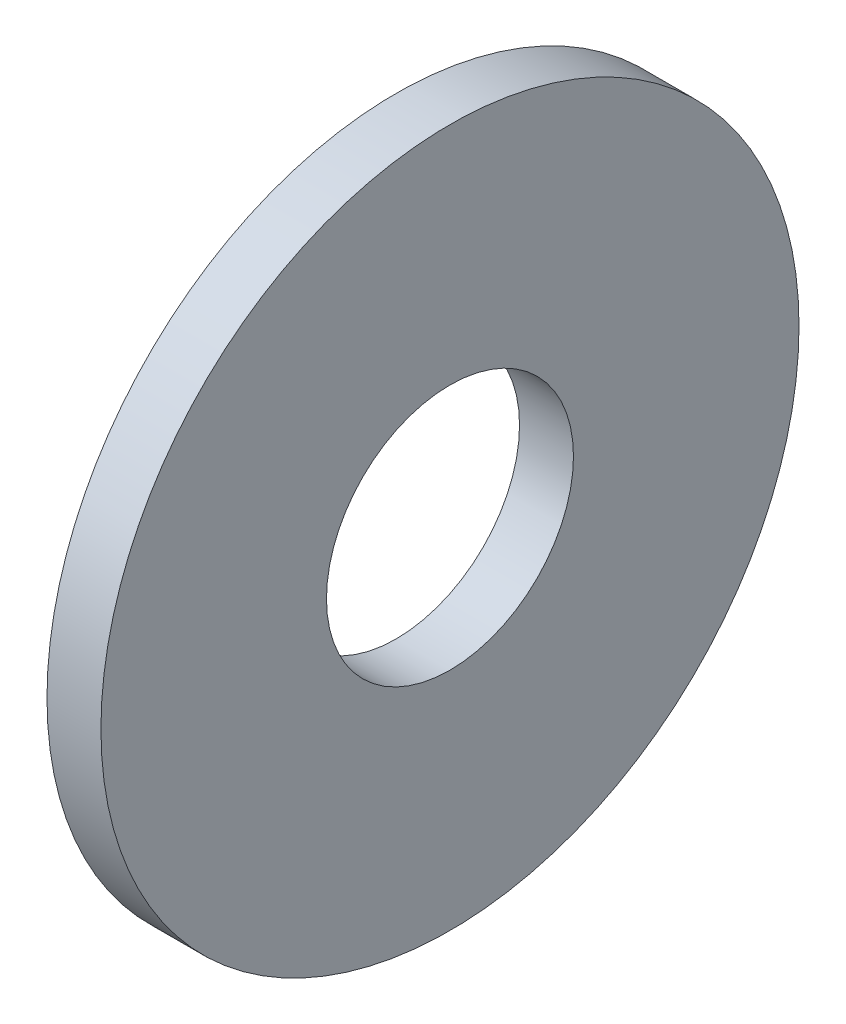
from build123d import *

# Parameters (mm, degrees)
SKETCH1_W = 8.5
SKETCH1_H = 35.54


with BuildPart() as part:
    # Sketch1 → Base-Revolve (revolve)
    with BuildSketch(Plane.XY):
        with Locations((-4.25, 37.23)):
            Rectangle(SKETCH1_W, SKETCH1_H)
    revolve(axis=Axis((-34.925, 0, 0), (1, 0, 0)))


solid = part.part
